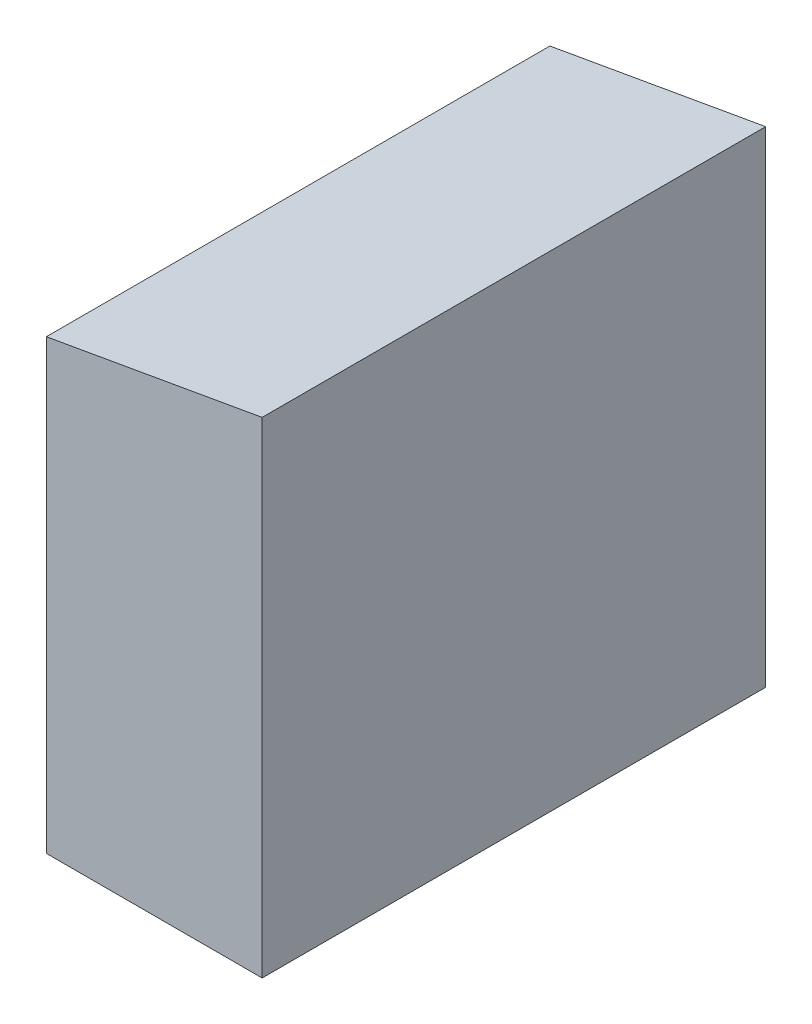
from build123d import *

# Parameters (mm, degrees)
BOSS_EXTRUDE1_DEPTH = 88.9


with BuildPart() as part:
    # Sketch2 → Boss-Extrude1 (new body)
    with BuildSketch(Plane.XY):
        Polygon((38.1, 85.718057965), (0, 79), (0, 0), (38.1, 0), align=None)
    extrude(amount=BOSS_EXTRUDE1_DEPTH)


solid = part.part
